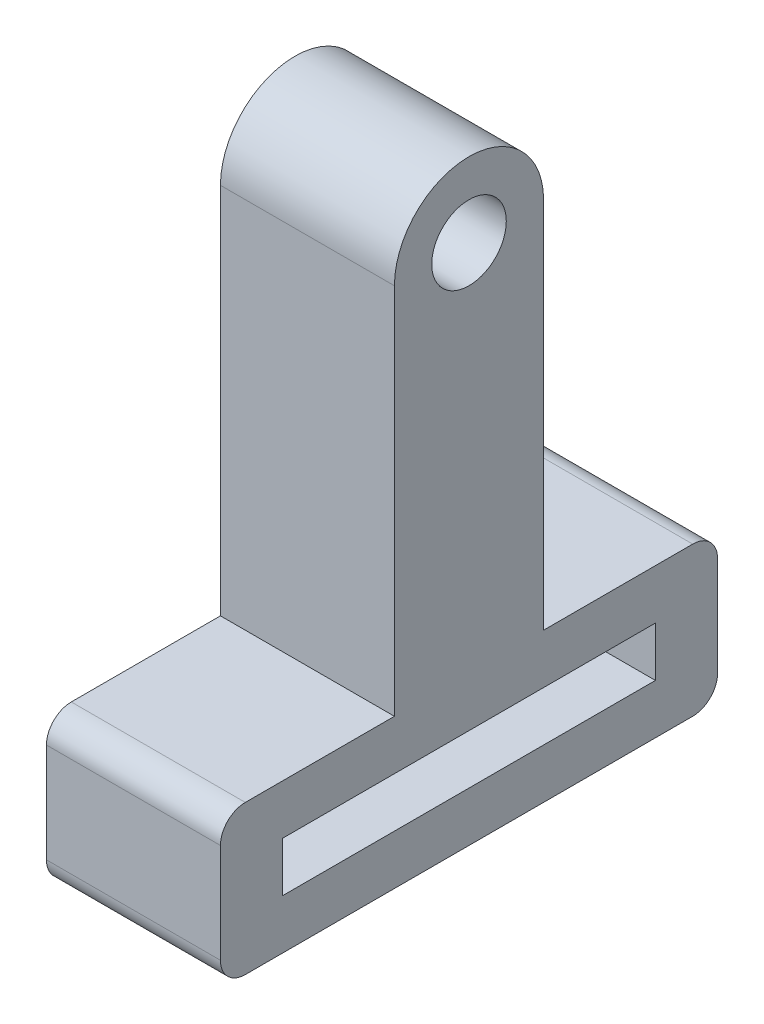
from build123d import *

# Parameters (mm, degrees)
CROQUIS1_R              = 1.5
CROQUIS1_W              = 15
CROQUIS1_H              = 2
SALIENTE_EXTRUIR1_DEPTH = 3.5
REDONDEO1_R             = 1


with BuildPart() as part:
    # Croquis1 → Saliente-Extruir1 (new, symmetric)
    with BuildSketch(Plane(origin=(0, 0, 0), x_dir=(0, 0, -1), z_dir=(1, 0, 0))):
        with BuildLine():
            Line((-10, 3), (-10, -3))
            Line((-10, -3), (10, -3))
            Line((10, -3), (10, 3))
            Line((10, 3), (3, 3))
            Line((3, 3), (3, 18))
            ThreePointArc((3, 18), (0, 21), (-3, 18))
            Line((-3, 18), (-3, 3))
            Line((-3, 3), (-10, 3))
        make_face()
        with Locations((0, 18)):
            Circle(CROQUIS1_R, mode=Mode.SUBTRACT)
        Rectangle(CROQUIS1_W, CROQUIS1_H, mode=Mode.SUBTRACT)
    extrude(amount=SALIENTE_EXTRUIR1_DEPTH, both=True)

    # Redondeo1
    redondeo1_edges = [part.edges().sort_by_distance(p)[0] for p in [
        (0, -3, -10),
        (0, -3, 10),
        (0, 3, -10),
        (0, 3, 10),
    ]]
    fillet(redondeo1_edges, radius=REDONDEO1_R)


solid = part.part
